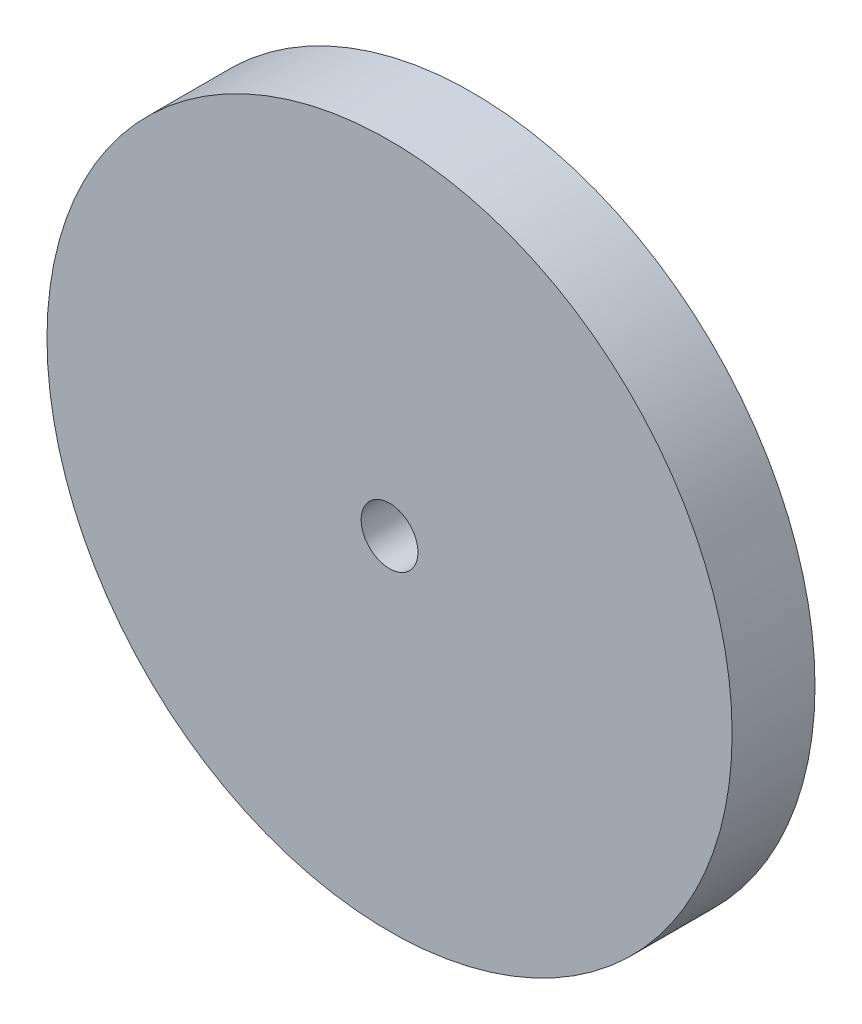
from build123d import *

# Parameters (mm, degrees)
SKETCH1_R           = 24.145
SKETCH1_R_2         = 2
BOSS_EXTRUDE1_DEPTH = 5.842


with BuildPart() as part:
    # Sketch1 → Boss-Extrude1 (new body)
    with BuildSketch(Plane.XY.offset(4.7625)):
        with Locations((-44.698640427, 0)):
            Circle(SKETCH1_R)
        with Locations((-44.698640427, 0)):
            Circle(SKETCH1_R_2, mode=Mode.SUBTRACT)
    extrude(amount=BOSS_EXTRUDE1_DEPTH)


solid = part.part
